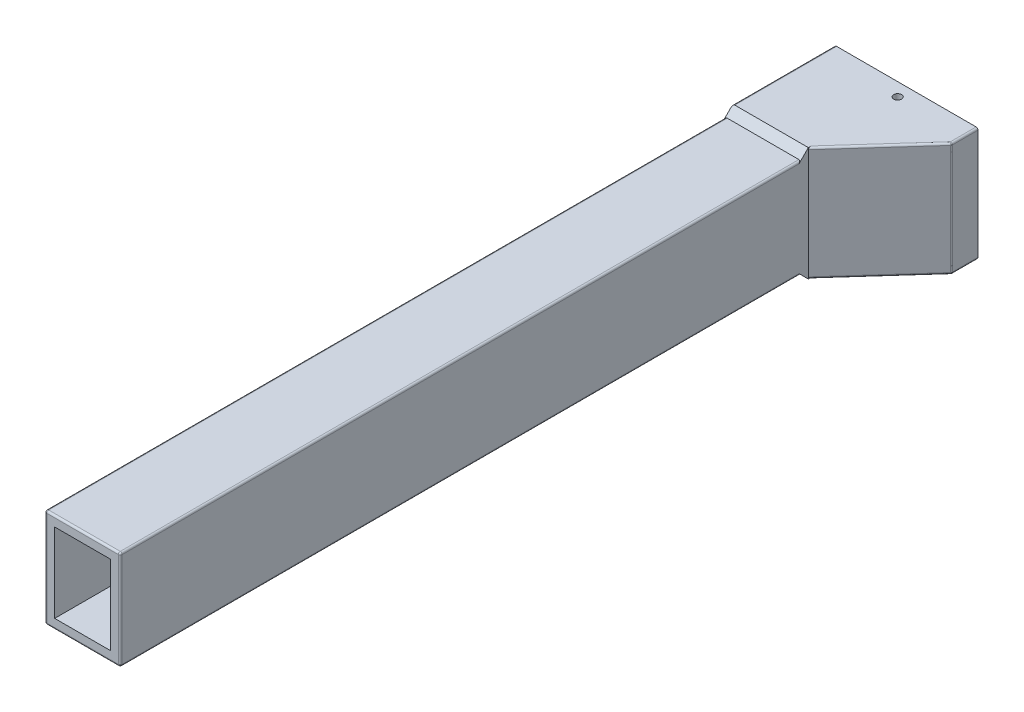
from build123d import *

# Parameters (mm, degrees)
SKETCH1_W               = 20
SKETCH1_H               = 26.2
SKETCH1_W_2             = 14.8
SKETCH1_H_2             = 21
TOP_DEPTH               = 20
SKETCH2_W               = 20
SKETCH2_H               = 26.2
SKETCH2_W_2             = 16.4
SKETCH2_H_2             = 22.6
BODY_DEPTH              = 162.5
SKETCH13_W              = 38
SKETCH13_H              = 26.2
SKETCH13_W_2            = 36.3
SKETCH13_H_2            = 24.5
INSERT_DEPTH            = 7
CUT_EXTRUDE1_DEPTH      = 212.889287248
CUT_EXTRUDE1_DEPTH_BACK = 212.889287248
SKETCH15_R              = 1.05
BOSS_EXTRUDE1_DEPTH     = 2
BOSS_EXTRUDE2_DEPTH     = 2
SKETCH19_R              = 1.05
BOSS_EXTRUDE3_DEPTH     = 2
BOSS_EXTRUDE4_START     = 2
SKETCH20_R              = 1.05
BOSS_EXTRUDE4_DEPTH     = 2
CHAMFER1_SIZE           = 2
FILLET1_R               = 0.5


# Some blends are built 0.0001 mm under size
with BuildPart() as part:
    # Sketch1 → Top (new body)
    with BuildSketch(Plane.XY):
        with Locations((0.9, 0)):
            Rectangle(SKETCH1_W, SKETCH1_H)
        with Locations((0.9, 0)):
            Rectangle(SKETCH1_W_2, SKETCH1_H_2, mode=Mode.SUBTRACT)
    extrude(amount=-TOP_DEPTH)

    # Sketch2 → Body (add)
    with BuildSketch(Plane(origin=(0, 0, -20), x_dir=(-1, 0, 0), z_dir=(0, 0, -1))):
        with Locations((-0.9, 0)):
            Rectangle(SKETCH2_W, SKETCH2_H)
        with Locations((-0.9, 0)):
            Rectangle(SKETCH2_W_2, SKETCH2_H_2, mode=Mode.SUBTRACT)
    extrude(amount=BODY_DEPTH)

    # Sketch10 → Loft3 section 0
    with BuildSketch(Plane(origin=(0, 0, -202.5), x_dir=(-1, 0, 0), z_dir=(0, 0, -1))):
        with BuildLine():
            Line((-28.9, -13.1), (9.1, -13.1))
            Line((9.1, -13.1), (9.1, 13.1))
            Line((9.1, 13.1), (-28.9, 13.1))
            Line((-28.9, 13.1), (-28.9, -13.1))
        make_face()
    # Sketch8 → Loft3 section 1
    with BuildSketch(Plane(origin=(0, 0, -182.5), x_dir=(-1, 0, 0), z_dir=(0, 0, -1))):
        with BuildLine():
            Line((9.1, 13.1), (-10.9, 13.1))
            Line((-10.9, 13.1), (-10.9, -13.1))
            Line((-10.9, -13.1), (9.1, -13.1))
            Line((9.1, -13.1), (9.1, 13.1))
        make_face()
    loft()

    # Sketch12 → Cut-Loft1 section 0
    with BuildSketch(Plane(origin=(0, 0, -202.5), x_dir=(-1, 0, 0), z_dir=(0, 0, -1))):
        with BuildLine():
            Line((7.3, -11.3), (7.3, 11.3))
            Line((7.3, 11.3), (-27.1, 11.3))
            Line((-27.1, 11.3), (-27.1, -11.3))
            Line((-27.1, -11.3), (7.3, -11.3))
        make_face()
    # Sketch11 → Cut-Loft1 section 1
    with BuildSketch(Plane(origin=(0, 0, -182.5), x_dir=(-1, 0, 0), z_dir=(0, 0, -1))):
        with BuildLine():
            Line((-9.1, 11.3), (-9.1, -11.3))
            Line((-9.1, -11.3), (7.3, -11.3))
            Line((7.3, -11.3), (7.3, 11.3))
            Line((7.3, 11.3), (-9.1, 11.3))
        make_face()
    loft(mode=Mode.SUBTRACT)

    # Sketch13 → Insert (add)
    with BuildSketch(Plane(origin=(0, 0, -202.5), x_dir=(-1, 0, 0), z_dir=(0, 0, -1))):
        with Locations((-9.9, 0)):
            Rectangle(SKETCH13_W, SKETCH13_H)
        with Locations((-9.9, 0)):
            Rectangle(SKETCH13_W_2, SKETCH13_H_2, mode=Mode.SUBTRACT)
    extrude(amount=INSERT_DEPTH)

    # Sketch15 → Cut-Extrude1 (cut, two sides: drawn at the far end of the back side and taken through both)
    with BuildSketch(Plane(origin=(0, 0, 0), x_dir=(1, 0, 0), z_dir=(0, 1, 0)).offset(-CUT_EXTRUDE1_DEPTH_BACK)):
        with Locations(Location((11.1, 206, 0), (0, 0, 270))):
            Circle(SKETCH15_R)
    extrude(amount=CUT_EXTRUDE1_DEPTH + CUT_EXTRUDE1_DEPTH_BACK, mode=Mode.SUBTRACT)

    # Sketch17 → Boss-Extrude1 (add)
    with BuildSketch(Plane.XZ.offset(-11.3)):
        Polygon((13.1, -202.5), (13.1, -186.944444444), (9.1, -182.5), (9.1, -202.5), align=None)
    extrude(amount=BOSS_EXTRUDE1_DEPTH)

    # Sketch18 → Boss-Extrude2 (add)
    with BuildSketch(Plane(origin=(0, -11.3, 0), x_dir=(1, 0, 0), z_dir=(0, 1, 0))):
        Polygon((13.1, 202.5), (9.1, 202.5), (9.1, 182.5), (13.1, 186.944444444), align=None)
    extrude(amount=BOSS_EXTRUDE2_DEPTH)

    # Sketch19 → Boss-Extrude3 (add)
    with BuildSketch(Plane.XZ.offset(13.1)):
        Polygon((28.9, -209.5), (-9.1, -209.5), (-9.1, -182.5), (10.9, -182.5), (28.9, -202.5), align=None)
        with Locations(Location((11.1, -206, 0), (0, 0, 90))):
            Circle(SKETCH19_R, mode=Mode.SUBTRACT)
    extrude(amount=BOSS_EXTRUDE3_DEPTH)

    # Sketch20 → Boss-Extrude4 (add)
    with BuildSketch(Plane(origin=(0, 13.1, 0), x_dir=(1, 0, 0), z_dir=(0, 1, 0)).offset(BOSS_EXTRUDE4_START)):
        Polygon((-9.1, 209.5), (28.9, 209.5), (28.9, 202.5), (10.9, 182.5), (-9.1, 182.5), align=None)
        with Locations(Location((11.1, 206, 0), (0, 0, 270))):
            Circle(SKETCH20_R, mode=Mode.SUBTRACT)
    extrude(amount=-BOSS_EXTRUDE4_DEPTH)

    # Chamfer1
    chamfer1_edges = [part.edges().sort_by_distance(p)[0] for p in [
        (0.9, 13.1, -182.5),
        (0.9, -13.1, -182.5),
    ]]
    chamfer(chamfer1_edges, length=CHAMFER1_SIZE - 0.0001)  # a hair under: the kernel refuses the full size

    # Fillet1
    # the kernel refuses this fillet: 0.5 mm, written as the material it takes off along each edge
    with BuildSketch(Plane(origin=(28.4, -14.6, -202.691868003), x_dir=(0.7432941462471656, 0, 0.6689647316224505), z_dir=(0, -1, 0))) as fillet1_piece_1_section:
        Polygon((0, 0), (FILLET1_R * 1.02, 0), (FILLET1_R * 1.02, -FILLET1_R * 0.391410725335), (FILLET1_R * 0.758160029172, -FILLET1_R * 0.682344026255), align=None)
    fillet1_piece_1 = extrude(amount=FILLET1_R * 1.02, mode=Mode.PRIVATE)
    fillet1_piece_1 = fillet1_piece_1 - Plane(origin=(28.4, -14.6, -202.691868003), x_dir=(-0.9336204116896668, 0, -0.3582637671833662), z_dir=(0, -1, 0)) * Sphere(FILLET1_R, mode=Mode.PRIVATE)
    add(fillet1_piece_1, mode=Mode.SUBTRACT)
    with BuildSketch(Plane(origin=(28.4, 14.6, -202.691868003), x_dir=(1, 0, 0), z_dir=(0, 1, 0))) as fillet1_piece_2_section:
        Polygon((0, 0), (FILLET1_R * 1.02, 0), (FILLET1_R * 1.02, -FILLET1_R * 0.391410725335), (FILLET1_R * 0.758160029172, -FILLET1_R * 0.682344026255), align=None)
    fillet1_piece_2 = extrude(amount=FILLET1_R * 1.02, mode=Mode.PRIVATE)
    fillet1_piece_2 = fillet1_piece_2 - Plane(origin=(28.4, 14.6, -202.691868003), x_dir=(-0.9336204116896668, 0, -0.3582637671833662), z_dir=(0, 1, 0)) * Sphere(FILLET1_R, mode=Mode.PRIVATE)
    add(fillet1_piece_2, mode=Mode.SUBTRACT)
    with BuildSketch(Plane(origin=(10.4, -12.6, -0.5), x_dir=(0, -1, 0), z_dir=(1, 0, 0))) as fillet1_piece_3_section:
        Polygon((0, 0), (FILLET1_R * 1.02, 0), (FILLET1_R * 1.02, -FILLET1_R * 1.02), (0, -FILLET1_R * 1.02), align=None)
    fillet1_piece_3 = extrude(amount=FILLET1_R * 1.02, mode=Mode.PRIVATE)
    fillet1_piece_3 = fillet1_piece_3 - Plane(origin=(10.4, -12.6, -0.5), x_dir=(0, 0.7071067811865475, -0.7071067811865475), z_dir=(1, 0, 0)) * Sphere(FILLET1_R, mode=Mode.PRIVATE)
    add(fillet1_piece_3, mode=Mode.SUBTRACT)
    with BuildSketch(Plane(origin=(-8.6, -12.6, -0.5), x_dir=(0, -1, 0), z_dir=(-1, 0, 0))) as fillet1_piece_4_section:
        Polygon((0, 0), (FILLET1_R * 1.02, 0), (FILLET1_R * 1.02, FILLET1_R * 1.02), (0, FILLET1_R * 1.02), align=None)
    fillet1_piece_4 = extrude(amount=FILLET1_R * 1.02, mode=Mode.PRIVATE)
    fillet1_piece_4 = fillet1_piece_4 - Plane(origin=(-8.6, -12.6, -0.5), x_dir=(0, 0.7071067811865475, -0.7071067811865475), z_dir=(-1, 0, 0)) * Sphere(FILLET1_R, mode=Mode.PRIVATE)
    add(fillet1_piece_4, mode=Mode.SUBTRACT)
    with BuildSketch(Plane(origin=(-8.6, 12.6, -0.5), x_dir=(0, 0, 1), z_dir=(-1, 0, 0))) as fillet1_piece_5_section:
        Polygon((0, 0), (FILLET1_R * 1.02, 0), (FILLET1_R * 1.02, FILLET1_R * 1.02), (0, FILLET1_R * 1.02), align=None)
    fillet1_piece_5 = extrude(amount=FILLET1_R * 1.02, mode=Mode.PRIVATE)
    fillet1_piece_5 = fillet1_piece_5 - Plane(origin=(-8.6, 12.6, -0.5), x_dir=(0, -0.7071067811865475, -0.7071067811865475), z_dir=(-1, 0, 0)) * Sphere(FILLET1_R, mode=Mode.PRIVATE)
    add(fillet1_piece_5, mode=Mode.SUBTRACT)
    with BuildSketch(Plane(origin=(10.4, 12.6, -0.5), x_dir=(0, 0, 1), z_dir=(1, 0, 0))) as fillet1_piece_6_section:
        Polygon((0, 0), (FILLET1_R * 1.02, 0), (FILLET1_R * 1.02, -FILLET1_R * 1.02), (0, -FILLET1_R * 1.02), align=None)
    fillet1_piece_6 = extrude(amount=FILLET1_R * 1.02, mode=Mode.PRIVATE)
    fillet1_piece_6 = fillet1_piece_6 - Plane(origin=(10.4, 12.6, -0.5), x_dir=(0, -0.7071067811865475, -0.7071067811865475), z_dir=(1, 0, 0)) * Sphere(FILLET1_R, mode=Mode.PRIVATE)
    add(fillet1_piece_6, mode=Mode.SUBTRACT)
    with BuildSketch(Plane(origin=(28.9, -15.1, -202.691868003), x_dir=(0, 1, 0), z_dir=(0, 0, -1))) as fillet1_piece_7:
        with BuildLine():
            CenterArc((FILLET1_R, -FILLET1_R), FILLET1_R, 90, 90)
            Line((0, -FILLET1_R), (0, 0))
            Line((0, 0), (FILLET1_R, 0))
        make_face()
    extrude(amount=8.058131997, mode=Mode.SUBTRACT)
    with BuildSketch(Plane(origin=(10.063794085, -15.1, -181.570882317), x_dir=(-0.7432941462471663, 0, -0.6689647316224498), z_dir=(0.6689647316224498, 0, -0.7432941462471663))) as fillet1_piece_8_section:
        with BuildLine():
            CenterArc((FILLET1_R, FILLET1_R), FILLET1_R, 180, 90)
            Line((0, FILLET1_R), (0, 0))
            Line((0, 0), (FILLET1_R, 0))
        make_face()
    fillet1_piece_8 = extrude(amount=27.965380092, mode=Mode.PRIVATE)
    fillet1_piece_8 = split(fillet1_piece_8, bisect_by=Plane(origin=(10.9, -14.988099969, -192.54912701), z_dir=(1, 0, 0)), keep=Keep.TOP, mode=Mode.PRIVATE)
    add(fillet1_piece_8, mode=Mode.SUBTRACT)
    with BuildSketch(Plane(origin=(-9.1, -15.1, -210.75), x_dir=(1, 0, 0), z_dir=(0, 0, 1)), Plane(origin=(-9.1, 15.1, -181.25), x_dir=(1, 0, 0), z_dir=(0, 0, -1))) as fillet1_piece_9:
        with BuildLine():
            CenterArc((FILLET1_R, FILLET1_R), FILLET1_R, 180, 90)
            Line((0, FILLET1_R), (0, 0))
            Line((0, 0), (FILLET1_R, 0))
        make_face()
    extrude(amount=29.5, mode=Mode.SUBTRACT)
    with BuildSketch(Plane(origin=(28.9, -14.6, -202.5), x_dir=(0, 0, -1), z_dir=(0, 1, 0))) as fillet1_piece_10:
        with BuildLine():
            CenterArc((FILLET1_R * 0.38373600523, FILLET1_R), FILLET1_R, 228.012787504, 41.987212496)
            Line((-FILLET1_R * 0.285228726392, FILLET1_R * 0.256705853753), (0, 0))
            Line((0, 0), (FILLET1_R * 0.38373600523, 0))
        make_face()
    extrude(amount=29.2, mode=Mode.SUBTRACT)
    with BuildSketch(Plane(origin=(28.771647073, 15.1, -202.357385637), x_dir=(-0.7432941462471662, 0, -0.66896473162245), z_dir=(-0.66896473162245, 0, 0.743294146247166))) as fillet1_piece_11_section:
        with BuildLine():
            CenterArc((FILLET1_R, FILLET1_R), FILLET1_R, 180, 90)
            Line((0, FILLET1_R), (0, 0))
            Line((0, 0), (FILLET1_R, 0))
        make_face()
    fillet1_piece_11 = extrude(amount=27.965380092, mode=Mode.PRIVATE)
    fillet1_piece_11 = split(fillet1_piece_11, bisect_by=Plane(origin=(10.9, 14.988099969, -192.54912701), z_dir=(1, 0, 0)), keep=Keep.TOP, mode=Mode.PRIVATE)
    add(fillet1_piece_11, mode=Mode.SUBTRACT)
    with BuildSketch(Plane(origin=(28.9, 15.1, -210.75), x_dir=(-1, 0, 0), z_dir=(0, 0, 1))) as fillet1_piece_12:
        with BuildLine():
            CenterArc((FILLET1_R, FILLET1_R), FILLET1_R, 180, 90)
            Line((0, FILLET1_R), (0, 0))
            Line((0, 0), (FILLET1_R, 0))
        make_face()
    extrude(amount=8.058131997, mode=Mode.SUBTRACT)
    with BuildSketch(Plane(origin=(10.9, -13.1, -0.5), x_dir=(0, 1, 0), z_dir=(0, 0, -1))) as fillet1_piece_13_section:
        with BuildLine():
            CenterArc((FILLET1_R, -FILLET1_R), FILLET1_R, 90, 90)
            Line((0, -FILLET1_R), (0, 0))
            Line((0, 0), (FILLET1_R, 0))
        make_face()
    fillet1_piece_13 = extrude(amount=181.2501, mode=Mode.PRIVATE)
    fillet1_piece_13 = split(fillet1_piece_13, bisect_by=Plane(origin=(10.788287286, 31.983751331, -135.416348669), z_dir=(2.2498580104233527e-15, -0.7071067811865469, 0.7071067811865481)), keep=Keep.TOP, mode=Mode.PRIVATE)
    add(fillet1_piece_13, mode=Mode.SUBTRACT)
    with BuildSketch(Plane(origin=(-9.1, -13.1, -0.5), x_dir=(0, 1, 0), z_dir=(0, 0, -1))) as fillet1_piece_14_section:
        with BuildLine():
            CenterArc((FILLET1_R, FILLET1_R), FILLET1_R, 180, 90)
            Line((0, FILLET1_R), (0, 0))
            Line((0, 0), (FILLET1_R, 0))
        make_face()
    fillet1_piece_14 = extrude(amount=181.2501, mode=Mode.PRIVATE)
    fillet1_piece_14 = split(fillet1_piece_14, bisect_by=Plane(origin=(-8.988287286, 31.983751331, -135.416348669), z_dir=(2.2498580104233527e-15, -0.7071067811865469, 0.7071067811865481)), keep=Keep.TOP, mode=Mode.PRIVATE)
    add(fillet1_piece_14, mode=Mode.SUBTRACT)
    with BuildSketch(Plane(origin=(-9.1, 13.1, -181.7501), x_dir=(0, -1, 0), z_dir=(0, 0, 1))) as fillet1_piece_15_section:
        with BuildLine():
            CenterArc((FILLET1_R, FILLET1_R), FILLET1_R, 180, 90)
            Line((0, FILLET1_R), (0, 0))
            Line((0, 0), (FILLET1_R, 0))
        make_face()
    fillet1_piece_15 = extrude(amount=181.2501, mode=Mode.PRIVATE)
    fillet1_piece_15 = split(fillet1_piece_15, bisect_by=Plane(origin=(-8.988287286, -31.983751331, -135.416348669), z_dir=(0, 0.7071067811865469, 0.7071067811865482)), keep=Keep.TOP, mode=Mode.PRIVATE)
    add(fillet1_piece_15, mode=Mode.SUBTRACT)
    with BuildSketch(Plane(origin=(10.9, 13.1, -181.7501), x_dir=(0, -1, 0), z_dir=(0, 0, 1))) as fillet1_piece_16_section:
        with BuildLine():
            CenterArc((FILLET1_R, -FILLET1_R), FILLET1_R, 90, 90)
            Line((0, -FILLET1_R), (0, 0))
            Line((0, 0), (FILLET1_R, 0))
        make_face()
    fillet1_piece_16 = extrude(amount=181.2501, mode=Mode.PRIVATE)
    fillet1_piece_16 = split(fillet1_piece_16, bisect_by=Plane(origin=(10.788287286, -31.983751331, -135.416348669), z_dir=(0, 0.7071067811865469, 0.7071067811865482)), keep=Keep.TOP, mode=Mode.PRIVATE)
    add(fillet1_piece_16, mode=Mode.SUBTRACT)
    with BuildSketch(Plane(origin=(-8.6, 13.1, 0), x_dir=(0, -1, 0), z_dir=(1, 0, 0)), Plane(origin=(10.4, -13.1, 0), x_dir=(0, 1, 0), z_dir=(-1, 0, 0))) as fillet1_piece_17:
        with BuildLine():
            CenterArc((FILLET1_R, FILLET1_R), FILLET1_R, 180, 90)
            Line((0, FILLET1_R), (0, 0))
            Line((0, 0), (FILLET1_R, 0))
        make_face()
    extrude(amount=19, mode=Mode.SUBTRACT)
    with BuildSketch(Plane(origin=(10.9, 12.6, 0), x_dir=(0, 0, -1), z_dir=(0, -1, 0))) as fillet1_piece_18:
        with BuildLine():
            CenterArc((FILLET1_R, -FILLET1_R), FILLET1_R, 90, 90)
            Line((0, -FILLET1_R), (0, 0))
            Line((0, 0), (FILLET1_R, 0))
        make_face()
    extrude(amount=25.2, mode=Mode.SUBTRACT)
    with BuildSketch(Plane(origin=(-9.1, -12.6, 0), x_dir=(1, 0, 0), z_dir=(0, 1, 0))) as fillet1_piece_19:
        with BuildLine():
            CenterArc((FILLET1_R, FILLET1_R), FILLET1_R, 180, 90)
            Line((0, FILLET1_R), (0, 0))
            Line((0, 0), (FILLET1_R, 0))
        make_face()
    extrude(amount=25.2, mode=Mode.SUBTRACT)


solid = part.part
